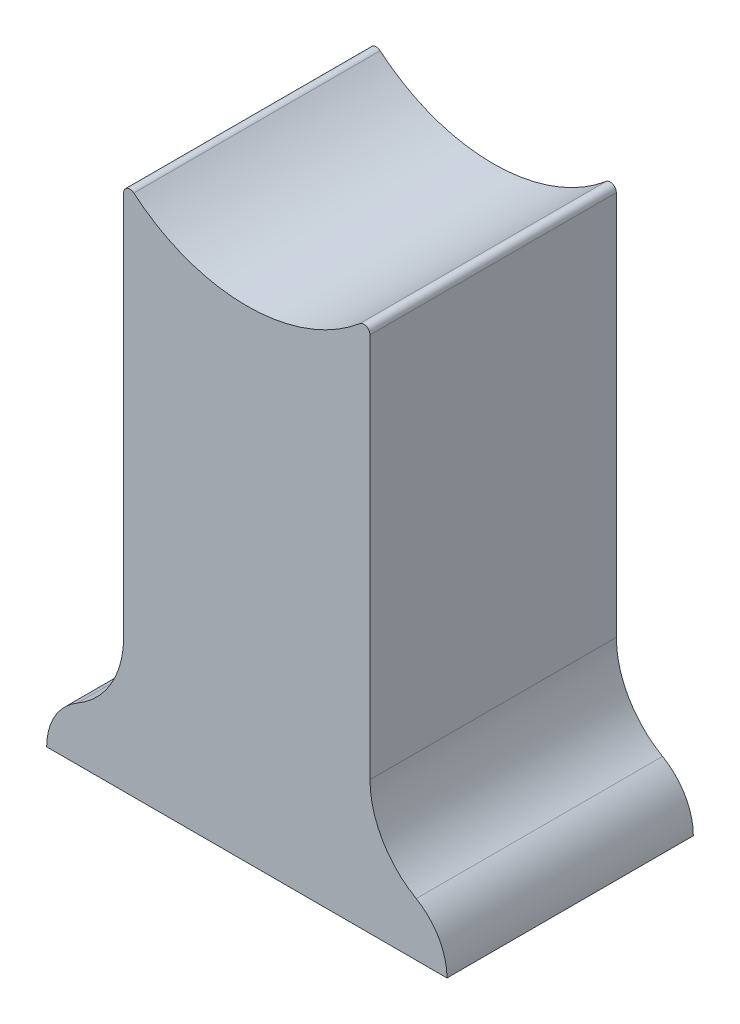
from build123d import *

# Parameters (mm, degrees)
EXTRUDE_1_DEPTH      = 40
FILLET_1_R           = 1
FILLET_2_R           = 10
FILLET_3_R           = 15
SHELL_1_T            = -4
EXTRUDE_2_REACH      = 101.561
EXTRUDE_2_END_RADIUS = 32.5
SKETCH_3_W           = 4
SKETCH_3_H           = 32
FILLET_4_R           = 6
EXTRUDE_3_DEPTH      = 2
EXTRUDE_3_DEPTH_BACK = 2
EXTRUDE_3_START      = -20


with BuildPart() as part:
    # 草图1 → 凸台-拉伸1 (new body)
    with BuildSketch(Plane.XY):
        with BuildLine():
            Line((-32.5, -106.75), (32.5, -106.75))
            Line((32.5, -106.75), (32.5, -96.75))
            Line((32.5, -96.75), (20, -96.75))
            Line((20, -96.75), (20, -20.303940504))
            ThreePointArc((20, -20.303940504), (0, -28.5), (-20, -20.303940504))
            Line((-20, -20.303940504), (-20, -96.75))
            Line((-20, -96.75), (-32.5, -96.75))
            Line((-32.5, -96.75), (-32.5, -106.75))
        make_face()
    extrude(amount=EXTRUDE_1_DEPTH)

    # 圆角1
    fillet_1_edges = [part.edges().sort_by_distance(p)[0] for p in [
        (-20, -20.303940504, 20),
        (20, -20.303940504, 20),
    ]]
    fillet(fillet_1_edges, radius=FILLET_1_R)

    # 圆角2
    fillet_2_edges = [part.edges().sort_by_distance(p)[0] for p in [
        (32.5, -96.75, 20),
        (-32.5, -96.75, 20),
    ]]
    fillet(fillet_2_edges, radius=FILLET_2_R - 0.0001)  # a hair under: the kernel refuses the full size

    # 圆角3
    fillet_3_edges = [part.edges().sort_by_distance(p)[0] for p in [
        (20, -96.75, 20),
        (-20, -96.75, 20),
    ]]
    fillet(fillet_3_edges, radius=FILLET_3_R)

    # 抽壳1
    shell_1_openings = [part.faces().sort_by_distance(p)[0] for p in [
        (0, -106.75, 20),
    ]]
    offset(amount=SHELL_1_T, openings=shell_1_openings)

    # 凸台-拉伸2: up to this cylinder (the profile starts outside it)
    extrude_2_end = Plane(origin=(0, 0, 20), z_dir=(0, 0, -1)) * Cylinder(EXTRUDE_2_END_RADIUS, 269.122, mode=Mode.PRIVATE)
    # 草图3 → 凸台-拉伸2 (add, up to the surface)
    with BuildSketch(Plane.XZ.offset(106.75), mode=Mode.PRIVATE) as extrude_2_sk1:
        with Locations((0, 20)):
            Rectangle(SKETCH_3_W, SKETCH_3_H)
    extrude_2_tool1 = extrude(extrude_2_sk1.sketch, amount=-EXTRUDE_2_REACH, mode=Mode.PRIVATE) - extrude_2_end
    add(extrude_2_tool1.solids().sort_by_distance((0, -106.75, 20))[0])

    # 圆角4
    fillet_4_edges = [part.edges().sort_by_distance(p)[0] for p in [
        (16, -28.28869032, 20),
        (-16, -28.28869032, 20),
        (-2, -32.438403167, 20),
        (2, -32.438403167, 20),
    ]]
    fillet(fillet_4_edges, radius=FILLET_4_R)

    # 草图5 → 凸台-拉伸3 (add, two sides: drawn at the far end of the back side and taken through both)
    with BuildSketch(Plane.XY.offset(40).offset(EXTRUDE_3_START - EXTRUDE_3_DEPTH_BACK)):
        with BuildLine():
            Line((-32.5, -106.75), (32.5, -106.75))
            ThreePointArc((32.5, -106.75), (31.160254038, -101.75), (27.5, -98.089745962))
            ThreePointArc((27.5, -98.089745962), (22.009618943, -92.599364905), (20, -85.099364905))
            Line((20, -85.099364905), (20, -22.566568193))
            ThreePointArc((20, -22.566568193), (19.421860287, -21.659907342), (18.355932203, -21.801599779))
            ThreePointArc((18.355932203, -21.801599779), (0, -28.5), (-18.355932203, -21.801599779))
            ThreePointArc((-18.355932203, -21.801599779), (-19.421860287, -21.659907342), (-20, -22.566568193))
            Line((-20, -22.566568193), (-20, -85.099364905))
            ThreePointArc((-20, -85.099364905), (-22.009618943, -92.599364905), (-27.5, -98.089745962))
            ThreePointArc((-27.5, -98.089745962), (-31.160254038, -101.75), (-32.5, -106.75))
        make_face()
    extrude(amount=EXTRUDE_3_DEPTH + EXTRUDE_3_DEPTH_BACK)


solid = part.part
